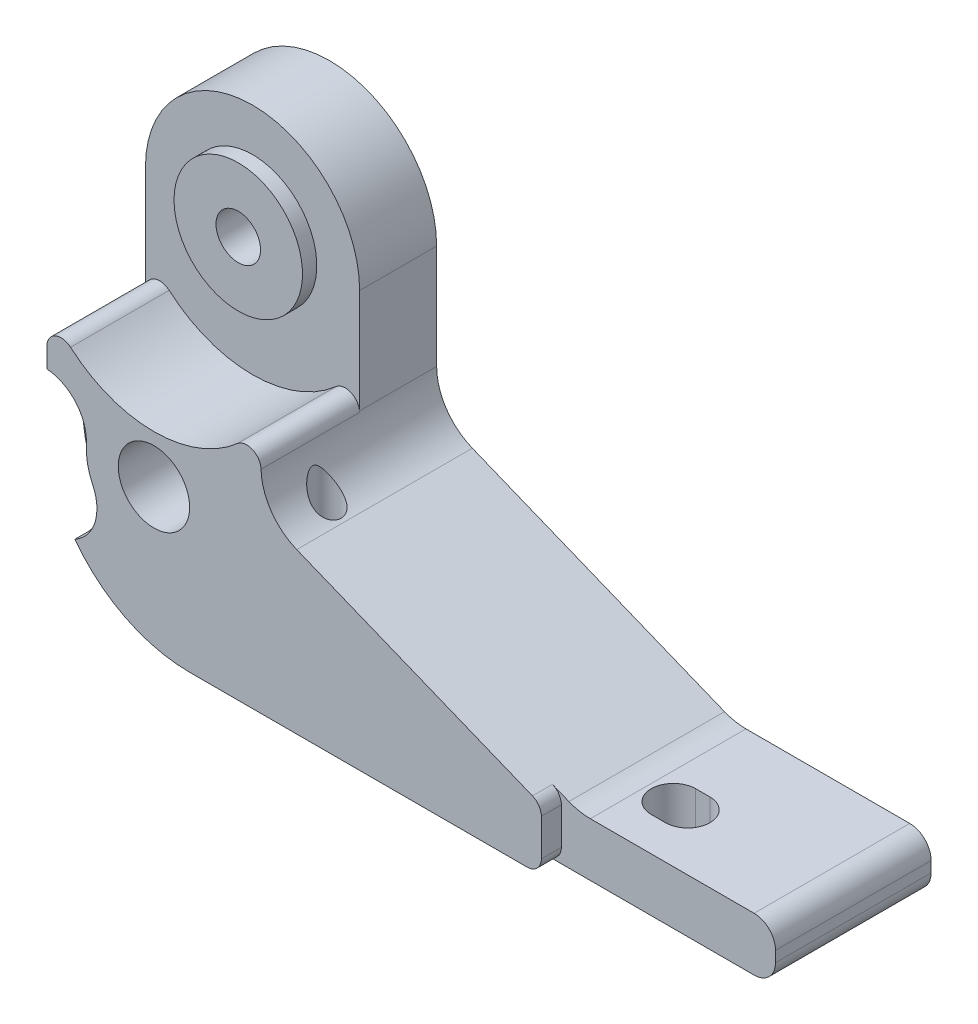
from build123d import *

# Parameters (mm, degrees)
SKETCH1_R             = 1.9812
SKETCH1_R_2           = 3.175
BOSS_EXTRUDE1_DEPTH   = 15.621
FILLET1_R             = 5.08
FILLET2_R             = 1.905
SKETCH2_R             = 11.25
CUT_EXTRUDE1_DEPTH    = 8.769999986
BOSS_EXTRUDE2_START   = 1.27
SKETCH3_R             = 5.715
SKETCH3_R_2           = 1.9812
BOSS_EXTRUDE2_DEPTH   = 1.27
FILLET3_R             = 1.27
BODY_MOVE_COPY1_ANGLE = 180
SKETCH4_W             = 19.05
SKETCH4_H             = 1.778
CUT_EXTRUDE2_DEPTH    = 67.693165799
FILLET4_R             = 1.27
FILLET5_R             = 12.7
CUT_EXTRUDE3_DEPTH    = 3.175
SKETCH6_R             = 1.27
CUT_EXTRUDE4_DEPTH    = 67.693165799
FILLET6_R             = 3.81
FILLET7_R             = 2.032
SKETCH7_R             = 2.54
CUT_EXTRUDE5_DEPTH    = 8.89


with BuildPart() as part:
    # Sketch1 → Boss-Extrude1 (new body)
    with BuildSketch(Plane.XY):
        with BuildLine():
            Line((-9.525, 0), (-9.525, 28.2))
            Line((-9.525, 28.2), (53.5118, 28.2))
            Line((53.5118, 28.2), (53.5118, 23.4375))
            Line((53.5118, 23.4375), (36.0493, 23.4375))
            Line((36.0493, 23.4375), (9.525, 12.7))
            Line((9.525, 12.7), (9.525, 0))
            ThreePointArc((9.525, 0), (0, -9.525), (-9.525, 0))
        make_face()
        with Locations(Location((0, 0, 0), (0, 0, 180))):
            Circle(SKETCH1_R, mode=Mode.SUBTRACT)
        with Locations(Location((0, 15.5, 0), (0, 0, 180))):
            Circle(SKETCH1_R_2, mode=Mode.SUBTRACT)
    extrude(amount=BOSS_EXTRUDE1_DEPTH)

    # Fillet1
    fillet1_edges = [part.edges().sort_by_distance(p)[0] for p in [
        (36.0493, 23.4375, 7.8105),
        (9.525, 12.7, 7.8105),
    ]]
    fillet(fillet1_edges, radius=FILLET1_R)

    # Fillet2
    fillet2_edges = [part.edges().sort_by_distance(p)[0] for p in [
        (53.5118, 28.2, 7.8105),
        (53.5118, 23.4375, 7.8105),
    ]]
    fillet(fillet2_edges, radius=FILLET2_R)

    # Sketch2 → Cut-Extrude1 (cut)
    with BuildSketch(Plane(origin=(0, 0, 0), x_dir=(-1, 0, 0), z_dir=(0, 0, -1))):
        Circle(SKETCH2_R)
    extrude(amount=-CUT_EXTRUDE1_DEPTH, mode=Mode.SUBTRACT)

    # Sketch3 → Boss-Extrude2 (add)
    with BuildSketch(Plane(origin=(0, 0, 8.769999986), x_dir=(-1, 0, 0), z_dir=(0, 0, -1)).offset(BOSS_EXTRUDE2_START)):
        Circle(SKETCH3_R)
        Circle(SKETCH3_R_2, mode=Mode.SUBTRACT)
    extrude(amount=-BOSS_EXTRUDE2_DEPTH)

    # Fillet3
    # the kernel refuses this fillet: 1.27 mm, written as the material it takes off along each edge
    with BuildSketch(Plane(origin=(-9.525, 5.986390816, 8.769999986), x_dir=(0, 1, 0), z_dir=(0, 0, -1))) as fillet3_piece_1:
        with BuildLine():
            CenterArc((3.426651997, 1.27), FILLET3_R, 138.750058465, 131.249941535)
            ThreePointArc((2.471814587, 2.107368211), (1.312365255, 0.964003573), (0, 0))
            Line((0, 0), (3.426651997, 0))
        make_face()
    extrude(amount=17.336629979, mode=Mode.SUBTRACT)
    with BuildSketch(Plane(origin=(9.525, 5.986390816, 8.769999986), x_dir=(-0.6487196430292314, 0.761027479627396, 0), z_dir=(0, 0, -1))) as fillet3_piece_2:
        with BuildLine():
            CenterArc((3.429739885, 1.256710275), FILLET3_R, 131.670192506, 130.033722059)
            Line((2.585390755, 2.205380158), (2.500955842, 2.300247146))
            ThreePointArc((2.500955842, 2.300247146), (2.421102629, 2.230690584), (-0.082387395, 0.09665049))
            Line((-0.082387395, 0.09665049), (0.018324651, -0.125671027))
            ThreePointArc((0.018324651, -0.125671027), (1.623246685, -0.009276057), (3.228168719, -0.125671027))
            Line((3.228168719, -0.125671027), (3.24649337, 0))
        make_face()
    extrude(amount=17.26556758, mode=Mode.SUBTRACT)


with BuildPart() as part_1:
    # Body-Move/Copy1: moved
    add(part.part.rotate(Axis((0, 6.7975, 6.35), (1, 0, 0)), BODY_MOVE_COPY1_ANGLE))

    # Sketch4 → Cut-Extrude2 (cut, through all)
    with BuildSketch(Plane.XZ.offset(14.605)):
        with Locations((43.9868, 11.811)):
            Rectangle(SKETCH4_W, SKETCH4_H)
    extrude(amount=-CUT_EXTRUDE2_DEPTH, mode=Mode.SUBTRACT)

    # Fillet4
    fillet4_edges = [part_1.edges().sort_by_distance(p)[0] for p in [
        (34.4618, -9.199852268, 11.811),
        (34.4618, -14.605, 11.811),
    ]]
    fillet(fillet4_edges, radius=FILLET4_R)

    # Fillet5
    fillet5_edges = [part_1.edges().sort_by_distance(p)[0] for p in [
        (-9.525, -14.605, 4.8895),
    ]]
    fillet(fillet5_edges, radius=FILLET5_R)

    # Sketch5 → Cut-Extrude3 (cut)
    with BuildSketch(Plane.XY.offset(12.7)):
        with BuildLine():
            ThreePointArc((-5.408855404, 0.750246956), (-5.911348625, -3.072052101), (-3.993935769, -6.416599523))
            ThreePointArc((-3.993935769, -6.416599523), (-15.75834811, -5.016102801), (-5.408855404, 0.750246956))
        make_face()
    extrude(amount=-CUT_EXTRUDE3_DEPTH, mode=Mode.SUBTRACT)

    # Sketch6 → Cut-Extrude4 (cut, through all)
    with BuildSketch(Plane.XZ.offset(14.605)):
        with Locations(Location((11.125, 8.4455, 0), (0, 0, 270))):
            Circle(SKETCH6_R)
        with BuildLine():
            Line((39.416476, 7.8867), (40.686476, 7.8867))
            ThreePointArc((40.686476, 7.8867), (42.667676, 5.9055), (40.686476, 3.9243))
            Line((40.686476, 3.9243), (39.416476, 3.9243))
            ThreePointArc((39.416476, 3.9243), (37.435276, 5.9055), (39.416476, 7.8867))
        make_face()
    extrude(amount=-CUT_EXTRUDE4_DEPTH, mode=Mode.SUBTRACT)

    # Fillet6
    # the kernel refuses this fillet: 3.81 mm, written as the material it adds along each edge
    with BuildSketch(Plane(origin=(-5.408855404, 0.750246956, 12.7), x_dir=(-0.2519962053537531, -0.9677282224298872, 0), z_dir=(0, 0, -1))) as fillet6_piece_1:
        with BuildLine():
            CenterArc((3.176013598, 3.732834284), FILLET6_R, 169.868712544, 88.580194717)
            Line((-0.574578104, 4.403029693), (-0.649589938, 4.416433601))
            ThreePointArc((-0.649589938, 4.416433601), (-0.768643464, 2.138699984), (-0.067078157, -0.036151913))
            Line((-0.067078157, -0.036151913), (0.015258417, -0.074656686))
            ThreePointArc((0.015258417, -0.074656686), (1.20654638, 0.045836272), (2.397834343, -0.074656686))
            Line((2.397834343, -0.074656686), (2.41309276, 0))
        make_face()
    extrude(amount=14.275903813)
    with BuildSketch(Plane(origin=(-3.993935769, -6.416599523, 12.7), x_dir=(-0.7064973640588543, -0.7077156735426245, 0), z_dir=(0, 0, -1))) as fillet6_piece_2_section:
        with BuildLine():
            CenterArc((3.250231885, 3.662124285), FILLET6_R, 199.612026349, 86.403394204)
            Line((-0.338738664, 2.383300453), (-0.410518075, 2.357723976))
            ThreePointArc((-0.410518075, 2.357723976), (-0.12457926, 1.198016243), (-0.076063221, 0.004563593))
            Line((-0.076063221, 0.004563593), (-0.026317873, -0.071510905))
            ThreePointArc((-0.026317873, -0.071510905), (2.150697936, -0.459393071), (4.322419151, -0.073242486))
            Line((4.322419151, -0.073242486), (4.301395871, 0))
        make_face()
    fillet6_piece_2 = extrude(amount=13.928489678, mode=Mode.PRIVATE)
    fillet6_piece_2 = fillet6_piece_2 & Plane(origin=(3.175, -1.905, 11.1125), x_dir=(-1, 0, 0), z_dir=(0, 0, -1)) * Cylinder(12.7, 46, mode=Mode.PRIVATE)
    add(fillet6_piece_2)

    # Fillet7
    fillet7_edges = [part_1.edges().sort_by_distance(p)[0] for p in [
        (-5.910770655, -3.074975831, 9.525),
        (-5.253622107, -7.292001089, 9.525),
        (-6.956861839, 1.129272671, 9.525),
    ]]
    fillet(fillet7_edges, radius=FILLET7_R)

    # Sketch7 → Cut-Extrude5 (cut)
    with BuildSketch(Plane.XZ.offset(14.605)):
        with Locations(Location((11.125, 8.4455, 0), (0, 0, 270))):
            Circle(SKETCH7_R)
    extrude(amount=-CUT_EXTRUDE5_DEPTH, mode=Mode.SUBTRACT)


solid = part_1.part
